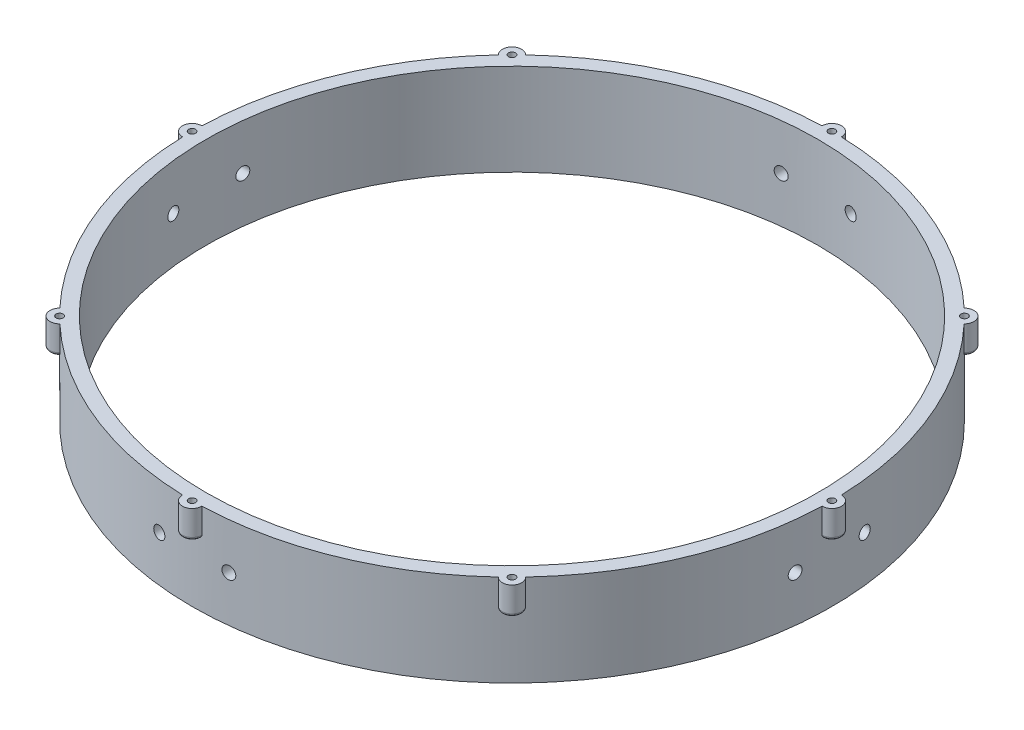
from build123d import *

# Parameters (mm, degrees)
SKETCH1_R                   = 115
SKETCH1_R_2                 = 110
RING_EXTRUSION_DEPTH        = 33
MARKER_HOLDERS_SKETCH_R     = 3.465
MARKER_POSTS_DEPTH          = 10
FILLET1_R                   = 1
MARKER_PATTERN_COUNT        = 8
FILLET1_OF_MARKER_PATTERN_R = 1
SKETCH3_R                   = 2.25
CUT_EXTRUDE1_DEPTH          = 171.753953114
CIRPATTERN1_COUNT           = 4


with BuildPart() as part:
    # Sketch1 → ring extrusion (new body)
    with BuildSketch(Plane(origin=(0, 0, 0), x_dir=(1, 0, 0), z_dir=(0, 1, 0))):
        with Locations(Location((0, 0, 0), (0, 0, 270))):
            Circle(SKETCH1_R)
        with Locations(Location((0, 0, 0), (0, 0, 270))):
            Circle(SKETCH1_R_2, mode=Mode.SUBTRACT)
    extrude(amount=RING_EXTRUSION_DEPTH)

    # marker holders sketch → marker posts (add)
    with BuildSketch(Plane(origin=(0, 33, 0), x_dir=(1, 0, 0), z_dir=(0, 1, 0))):
        with Locations((0, 115)):
            Circle(MARKER_HOLDERS_SKETCH_R)
    marker_posts = extrude(amount=-MARKER_POSTS_DEPTH)

    # Sketch10 → Tap Drill for M3x0.5 Tap2 (revolve, cut)
    with BuildSketch(Plane(origin=(0, 33, -115), x_dir=(0, 0, 1), z_dir=(1, 0, 0))):
        Polygon((0, 0), (0, 5.751075774), (1.25, 5), (1.25, 0), align=None)
    tap_drill_for_m3x0_5_tap2 = revolve(axis=Axis((0, 39.35, -115), (0, -1, 0)), mode=Mode.SUBTRACT)

    # Fillet1
    # the kernel refuses this fillet: 1 mm, written as the material it takes off along each edge
    with BuildSketch(Plane(origin=(0, 23, -115), x_dir=(0.7399843685402785, 0, 0.672624066114234), z_dir=(-0.672624066114234, 0, 0.7399843685402785))) as fillet1_piece_1_section:
        with BuildLine():
            CenterArc((3.465 - FILLET1_R, FILLET1_R), FILLET1_R, 270, 90)
            Line((3.465 - FILLET1_R, 0), (3.465, 0))
            Line((3.465, 0), (3.465, FILLET1_R))
        make_face()
    fillet1_piece_1 = revolve(axis=Axis((0, 23, -115), (0, 1, 0)), revolution_arc=264.539831946, mode=Mode.PRIVATE)
    fillet1_piece_1 = fillet1_piece_1 - Plane(origin=(0, 23.283147813, 0), x_dir=(0, 0, 1), z_dir=(0, -1, 0)) * Cylinder(115, 14, mode=Mode.PRIVATE)
    add(fillet1_piece_1, mode=Mode.SUBTRACT)

    # marker pattern: marker posts, Tap Drill for M3x0.5 Tap2 ×8 about axis
    marker_pattern_axis = Axis((0, 0, 0), (0, 1, 0))
    add([marker_posts.rotate(marker_pattern_axis, i * 360 / MARKER_PATTERN_COUNT) for i in range(1, MARKER_PATTERN_COUNT)])
    add([tap_drill_for_m3x0_5_tap2.rotate(marker_pattern_axis, i * 360 / MARKER_PATTERN_COUNT) for i in range(1, MARKER_PATTERN_COUNT)], mode=Mode.SUBTRACT)

    # Fillet1 of marker pattern
    # the kernel refuses this fillet: 1 mm, written as the material it takes off along each edge
    with BuildSketch(Plane(origin=(-81.317279836, 23, -81.317279836), x_dir=(0.9988650033055204, 0, -0.04763092662821825), z_dir=(0.04763092662821825, 0, 0.9988650033055204))) as fillet1_of_marker_pattern_piece_1_section:
        with BuildLine():
            CenterArc((3.465 - FILLET1_OF_MARKER_PATTERN_R, FILLET1_OF_MARKER_PATTERN_R), FILLET1_OF_MARKER_PATTERN_R, 270, 90)
            Line((3.465 - FILLET1_OF_MARKER_PATTERN_R, 0), (3.465, 0))
            Line((3.465, 0), (3.465, FILLET1_OF_MARKER_PATTERN_R))
        make_face()
    fillet1_of_marker_pattern_piece_1 = revolve(axis=Axis((-81.317279836, 23, -81.317279836), (0, 1, 0)), revolution_arc=264.539831946, mode=Mode.PRIVATE)
    fillet1_of_marker_pattern_piece_1 = fillet1_of_marker_pattern_piece_1 - Plane(origin=(0, 23.283147813, 0), x_dir=(0, 0, 1), z_dir=(0, -1, 0)) * Cylinder(115, 14, mode=Mode.PRIVATE)
    add(fillet1_of_marker_pattern_piece_1, mode=Mode.SUBTRACT)
    with BuildSketch(Plane(origin=(-115, 23, 0), x_dir=(0.672624066114255, 0, -0.7399843685402593), z_dir=(0.7399843685402593, 0, 0.672624066114255))) as fillet1_of_marker_pattern_piece_2_section:
        with BuildLine():
            CenterArc((3.465 - FILLET1_OF_MARKER_PATTERN_R, FILLET1_OF_MARKER_PATTERN_R), FILLET1_OF_MARKER_PATTERN_R, 270, 90)
            Line((3.465 - FILLET1_OF_MARKER_PATTERN_R, 0), (3.465, 0))
            Line((3.465, 0), (3.465, FILLET1_OF_MARKER_PATTERN_R))
        make_face()
    fillet1_of_marker_pattern_piece_2 = revolve(axis=Axis((-115, 23, 0), (0, 1, 0)), revolution_arc=264.539831946, mode=Mode.PRIVATE)
    fillet1_of_marker_pattern_piece_2 = fillet1_of_marker_pattern_piece_2 - Plane(origin=(0, 23.283147813, 0), x_dir=(0, 0, 1), z_dir=(0, -1, 0)) * Cylinder(115, 14, mode=Mode.PRIVATE)
    add(fillet1_of_marker_pattern_piece_2, mode=Mode.SUBTRACT)
    with BuildSketch(Plane(origin=(-81.317279836, 23, 81.317279836), x_dir=(-0.04763092662821825, 0, -0.9988650033055204), z_dir=(0.9988650033055204, 0, -0.04763092662821825))) as fillet1_of_marker_pattern_piece_3_section:
        with BuildLine():
            CenterArc((3.465 - FILLET1_OF_MARKER_PATTERN_R, FILLET1_OF_MARKER_PATTERN_R), FILLET1_OF_MARKER_PATTERN_R, 270, 90)
            Line((3.465 - FILLET1_OF_MARKER_PATTERN_R, 0), (3.465, 0))
            Line((3.465, 0), (3.465, FILLET1_OF_MARKER_PATTERN_R))
        make_face()
    fillet1_of_marker_pattern_piece_3 = revolve(axis=Axis((-81.317279836, 23, 81.317279836), (0, 1, 0)), revolution_arc=264.539831946, mode=Mode.PRIVATE)
    fillet1_of_marker_pattern_piece_3 = fillet1_of_marker_pattern_piece_3 - Plane(origin=(0, 23.283147813, 0), x_dir=(0, 0, 1), z_dir=(0, -1, 0)) * Cylinder(115, 14, mode=Mode.PRIVATE)
    add(fillet1_of_marker_pattern_piece_3, mode=Mode.SUBTRACT)
    with BuildSketch(Plane(origin=(0, 23, 115), x_dir=(0.7399843685402785, 0, -0.672624066114234), z_dir=(-0.672624066114234, 0, -0.7399843685402785))) as fillet1_of_marker_pattern_piece_4_section:
        with BuildLine():
            CenterArc((3.465 - FILLET1_OF_MARKER_PATTERN_R, -FILLET1_OF_MARKER_PATTERN_R), FILLET1_OF_MARKER_PATTERN_R, 0, 90)
            Line((3.465, -FILLET1_OF_MARKER_PATTERN_R), (3.465, 0))
            Line((3.465, 0), (3.465 - FILLET1_OF_MARKER_PATTERN_R, 0))
        make_face()
    fillet1_of_marker_pattern_piece_4 = revolve(axis=Axis((0, 23, 115), (0, -1, 0)), revolution_arc=264.539831946, mode=Mode.PRIVATE)
    fillet1_of_marker_pattern_piece_4 = fillet1_of_marker_pattern_piece_4 - Plane(origin=(0, 23.283147813, 0), x_dir=(0, 0, 1), z_dir=(0, -1, 0)) * Cylinder(115, 14, mode=Mode.PRIVATE)
    add(fillet1_of_marker_pattern_piece_4, mode=Mode.SUBTRACT)
    with BuildSketch(Plane(origin=(81.317279836, 23, 81.317279836), x_dir=(-0.9988650033055196, 0, 0.04763092662823462), z_dir=(-0.04763092662823462, 0, -0.9988650033055196))) as fillet1_of_marker_pattern_piece_5_section:
        with BuildLine():
            CenterArc((3.465 - FILLET1_OF_MARKER_PATTERN_R, FILLET1_OF_MARKER_PATTERN_R), FILLET1_OF_MARKER_PATTERN_R, 270, 90)
            Line((3.465 - FILLET1_OF_MARKER_PATTERN_R, 0), (3.465, 0))
            Line((3.465, 0), (3.465, FILLET1_OF_MARKER_PATTERN_R))
        make_face()
    fillet1_of_marker_pattern_piece_5 = revolve(axis=Axis((81.317279836, 23, 81.317279836), (0, 1, 0)), revolution_arc=264.539831946, mode=Mode.PRIVATE)
    fillet1_of_marker_pattern_piece_5 = fillet1_of_marker_pattern_piece_5 - Plane(origin=(0, 23.283147813, 0), x_dir=(0, 0, 1), z_dir=(0, -1, 0)) * Cylinder(115, 14, mode=Mode.PRIVATE)
    add(fillet1_of_marker_pattern_piece_5, mode=Mode.SUBTRACT)
    with BuildSketch(Plane(origin=(115, 23, 0), x_dir=(-0.672624066114211, 0, 0.7399843685402994), z_dir=(-0.7399843685402994, 0, -0.672624066114211))) as fillet1_of_marker_pattern_piece_6_section:
        with BuildLine():
            CenterArc((3.465 - FILLET1_OF_MARKER_PATTERN_R, FILLET1_OF_MARKER_PATTERN_R), FILLET1_OF_MARKER_PATTERN_R, 270, 90)
            Line((3.465 - FILLET1_OF_MARKER_PATTERN_R, 0), (3.465, 0))
            Line((3.465, 0), (3.465, FILLET1_OF_MARKER_PATTERN_R))
        make_face()
    fillet1_of_marker_pattern_piece_6 = revolve(axis=Axis((115, 23, 0), (0, 1, 0)), revolution_arc=264.539831946, mode=Mode.PRIVATE)
    fillet1_of_marker_pattern_piece_6 = fillet1_of_marker_pattern_piece_6 - Plane(origin=(0, 23.283147813, 0), x_dir=(0, 0, 1), z_dir=(0, -1, 0)) * Cylinder(115, 14, mode=Mode.PRIVATE)
    add(fillet1_of_marker_pattern_piece_6, mode=Mode.SUBTRACT)
    with BuildSketch(Plane(origin=(81.317279836, 23, -81.317279836), x_dir=(0.04763092662825937, 0, 0.9988650033055185), z_dir=(-0.9988650033055185, 0, 0.04763092662825937))) as fillet1_of_marker_pattern_piece_7_section:
        with BuildLine():
            CenterArc((3.465 - FILLET1_OF_MARKER_PATTERN_R, FILLET1_OF_MARKER_PATTERN_R), FILLET1_OF_MARKER_PATTERN_R, 270, 90)
            Line((3.465 - FILLET1_OF_MARKER_PATTERN_R, 0), (3.465, 0))
            Line((3.465, 0), (3.465, FILLET1_OF_MARKER_PATTERN_R))
        make_face()
    fillet1_of_marker_pattern_piece_7 = revolve(axis=Axis((81.317279836, 23, -81.317279836), (0, 1, 0)), revolution_arc=264.539831946, mode=Mode.PRIVATE)
    fillet1_of_marker_pattern_piece_7 = fillet1_of_marker_pattern_piece_7 - Plane(origin=(0, 23.283147813, 0), x_dir=(0, 0, 1), z_dir=(0, -1, 0)) * Cylinder(115, 14, mode=Mode.PRIVATE)
    add(fillet1_of_marker_pattern_piece_7, mode=Mode.SUBTRACT)

    # Sketch3 → Cut-Extrude1 (cut, through all)
    with BuildSketch(Plane.XY):
        with Locations((12.5, 16.5)):
            Circle(SKETCH3_R)
        with Locations((-12.5, 16.5)):
            Circle(SKETCH3_R)
    cut_extrude1 = extrude(amount=-CUT_EXTRUDE1_DEPTH, mode=Mode.SUBTRACT)

    # CirPattern1: Cut-Extrude1 ×4 about axis
    cirpattern1_axis = Axis((0, 0, 0), (0, -1, 0))
    for i in range(1, CIRPATTERN1_COUNT):
        add(cut_extrude1.rotate(cirpattern1_axis, i * 360 / CIRPATTERN1_COUNT), mode=Mode.SUBTRACT)


solid = part.part
